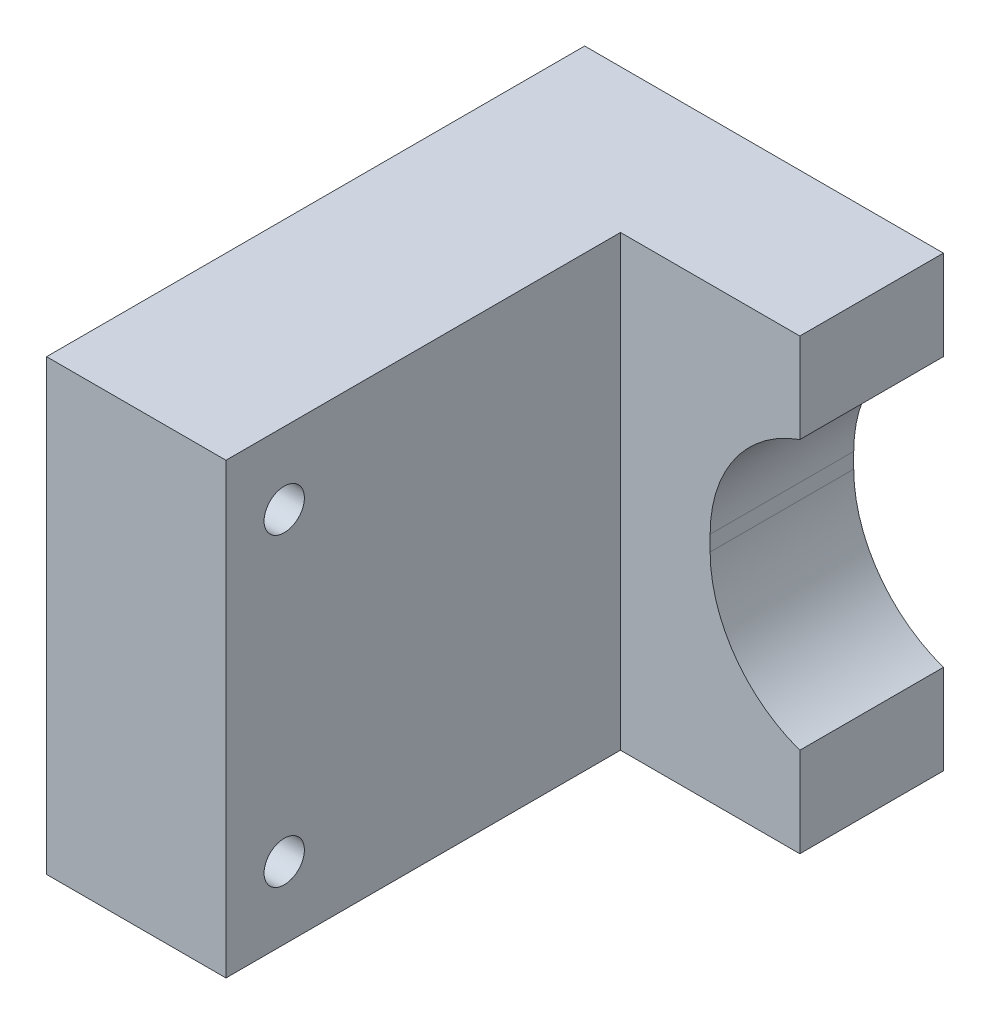
from build123d import *

# Parameters (mm, degrees)
SKETCH3_W                                         = 20
SKETCH3_H                                         = 60
SKETCH3_H_2                                       = 16.009607205
BOSS_EXTRUDE1_DEPTH                               = 50
SKETCH4_W                                         = 16.009607205
SKETCH4_H                                         = 30
CUT_EXTRUDE1_DEPTH                                = 10
FILLET4_R                                         = 15
CSK_FOR_8_FLAT_HEAD_MACHINE_SCREW_100_D           = 4.4958
CSK_FOR_8_FLAT_HEAD_MACHINE_SCREW_100_CSINK_D     = 8.4328
CSK_FOR_8_FLAT_HEAD_MACHINE_SCREW_100_CSINK_ANGLE = 100
SKETCH7_W                                         = 10
SKETCH7_H                                         = 20
CUT_EXTRUDE2_DEPTH                                = 50
SKETCH8_W                                         = 10
SKETCH8_H                                         = 20
CUT_EXTRUDE3_DEPTH                                = 13


with BuildPart() as part:
    # Sketch3 → Boss-Extrude1 (new body)
    with BuildSketch(Plane(origin=(0, 0, 0), x_dir=(1, 0, 0), z_dir=(0, 1, 0))):
        Rectangle(SKETCH3_W, SKETCH3_H)
        with Locations((20, 21.995196398)):
            Rectangle(SKETCH3_W, SKETCH3_H_2)
    extrude(amount=BOSS_EXTRUDE1_DEPTH)

    # Sketch4 → Cut-Extrude1 (cut)
    with BuildSketch(Plane(origin=(30, 0, 0), x_dir=(0, 0, -1), z_dir=(1, 0, 0))):
        with Locations((21.995196398, 25)):
            Rectangle(SKETCH4_W, SKETCH4_H)
    extrude(amount=-CUT_EXTRUDE1_DEPTH, mode=Mode.SUBTRACT)

    # Fillet4
    # the kernel refuses this fillet: 15 mm, written as the material it adds along each edge
    with BuildSketch(Plane(origin=(20, 10, -30), x_dir=(1, 0, 0), z_dir=(0, 0, 1))) as fillet4_piece_1:
        with BuildLine():
            CenterArc((15, 14.142135624), FILLET4_R, 180, 70.528779366)
            Line((0, 14.142135624), (-0.3, 14.142135624))
            Line((-0.3, 14.142135624), (-0.3, 0))
            Line((-0.3, 0), (0, -0.3))
            ThreePointArc((0, -0.3), (5, -0.3), (9.9, -0.282842712))
            Line((9.9, -0.282842712), (10, 0))
        make_face()
    extrude(amount=16.009607205)
    with BuildSketch(Plane(origin=(20, 40, -13.990392795), x_dir=(0, -1, 0), z_dir=(0, 0, -1))) as fillet4_piece_2:
        with BuildLine():
            CenterArc((14.142135624, -15), FILLET4_R, 90, 70.528779366)
            Line((0, -10), (-0.282842712, -9.9))
            ThreePointArc((-0.282842712, -9.9), (-0.3, -5), (-0.3, 0))
            Line((-0.3, 0), (0, 0.3))
            Line((0, 0.3), (14.142135624, 0.3))
            Line((14.142135624, 0.3), (14.142135624, 0))
        make_face()
    extrude(amount=16.009607205)

    # CSK for #8 Flat Head Machine Screw (100)1 (through all)
    with Locations(Plane.ZY.offset(10)):
        with Locations((23.5, 8), (23.5, 42)):
            CounterSinkHole(CSK_FOR_8_FLAT_HEAD_MACHINE_SCREW_100_D / 2, CSK_FOR_8_FLAT_HEAD_MACHINE_SCREW_100_CSINK_D / 2, counter_sink_angle=CSK_FOR_8_FLAT_HEAD_MACHINE_SCREW_100_CSINK_ANGLE)

    # Sketch7 → Cut-Extrude2 (cut)
    with BuildSketch(Plane(origin=(0, 0, -30), x_dir=(-1, 0, 0), z_dir=(0, 0, -1))):
        with Locations((2, 25)):
            Rectangle(SKETCH7_W, SKETCH7_H)
    extrude(amount=-CUT_EXTRUDE2_DEPTH, mode=Mode.SUBTRACT)

    # Sketch8 → Cut-Extrude3 (cut)
    with BuildSketch(Plane.ZY.offset(10)):
        with Locations((15, 25)):
            Rectangle(SKETCH8_W, SKETCH8_H)
    extrude(amount=-CUT_EXTRUDE3_DEPTH, mode=Mode.SUBTRACT)


solid = part.part
